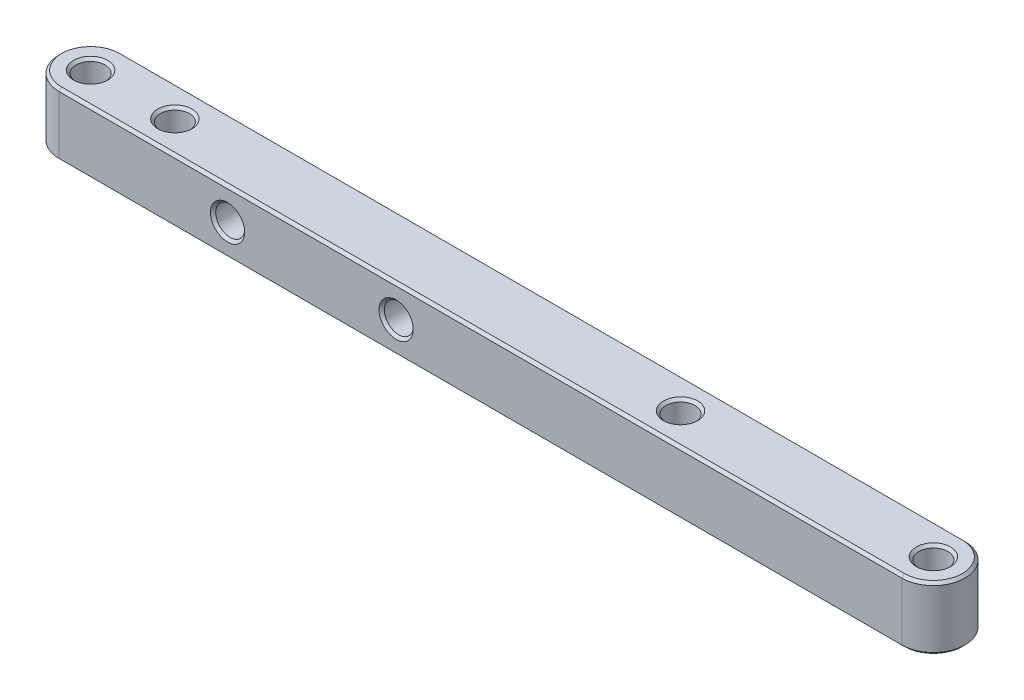
from build123d import *

# Parameters (mm, degrees)
SKETCH1_R               = 2.1828125
BOSS_EXTRUDE1_DEPTH     = 9.525
CUT_EXTRUDE1_DEPTH      = 133.449264461
CUT_EXTRUDE1_DEPTH_BACK = 133.449264461
SKETCH2_R               = 2.1828125
CHAMFER1_SIZE           = 0.396875


with BuildPart() as part:
    # Sketch1 → Boss-Extrude1 (new body)
    with BuildSketch(Plane(origin=(0, 0, 0), x_dir=(1, 0, 0), z_dir=(0, 1, 0))):
        with BuildLine():
            Line((0, 4.7625), (127, 4.7625))
            ThreePointArc((127, 4.7625), (131.7625, 0), (127, -4.7625))
            Line((127, -4.7625), (0, -4.7625))
            ThreePointArc((0, -4.7625), (-4.7625, 0), (0, 4.7625))
        make_face()
        Circle(SKETCH1_R, mode=Mode.SUBTRACT)
        with Locations((12.7, 0)):
            Circle(SKETCH1_R, mode=Mode.SUBTRACT)
        with Locations((127, 0)):
            Circle(SKETCH1_R, mode=Mode.SUBTRACT)
        with Locations((88.9, 0)):
            Circle(SKETCH1_R, mode=Mode.SUBTRACT)
    extrude(amount=BOSS_EXTRUDE1_DEPTH)

    # Sketch2 → Cut-Extrude1 (cut, two sides: drawn at the far end of the back side and taken through both)
    with BuildSketch(Plane.XY.offset(4.7625).offset(-CUT_EXTRUDE1_DEPTH_BACK)):
        with Locations((25.4, 4.7625)):
            Circle(SKETCH2_R)
        with Locations((50.8, 4.7625)):
            Circle(SKETCH2_R)
    extrude(amount=CUT_EXTRUDE1_DEPTH + CUT_EXTRUDE1_DEPTH_BACK, mode=Mode.SUBTRACT)

    # Chamfer1
    chamfer1_edges = [part.edges().sort_by_distance(p)[0] for p in [
        (23.2171875, 4.7625, 4.7625),
        (23.2171875, 4.7625, -4.7625),
        (48.6171875, 4.7625, 4.7625),
        (48.6171875, 4.7625, -4.7625),
        (86.7171875, 0, 0),
        (124.8171875, 0, 0),
        (10.5171875, 0, 0),
        (-2.1828125, 0, 0),
        (63.5, 0, 4.7625),
        (131.7625, 0, 0),
        (63.5, 0, -4.7625),
        (-4.7625, 0, 0),
        (86.7171875, 9.525, 0),
        (10.5171875, 9.525, 0),
        (63.5, 9.525, -4.7625),
        (131.7625, 9.525, 0),
        (63.5, 9.525, 4.7625),
        (-4.7625, 9.525, 0),
        (-2.1828125, 9.525, 0),
        (124.8171875, 9.525, 0),
    ]]
    chamfer(chamfer1_edges, length=CHAMFER1_SIZE)


solid = part.part
